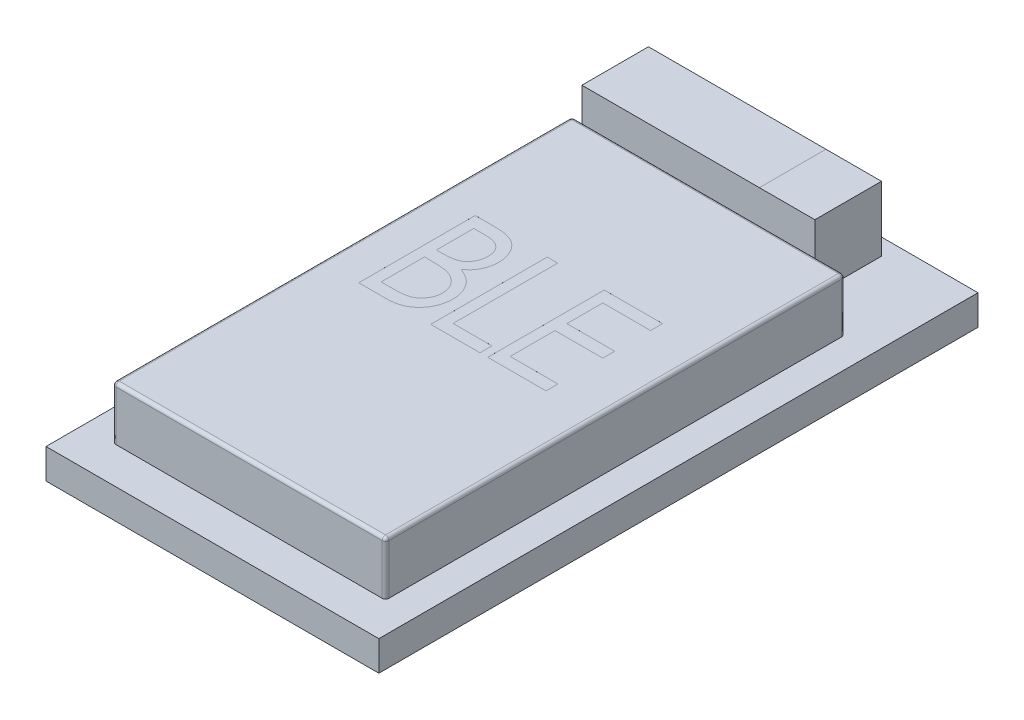
from build123d import *

# Parameters (mm, degrees)
SCHIZZO1_W                   = 10
SCHIZZO1_H                   = 18
ESTRUSIONE_ESTRUSIONE1_DEPTH = 0.9
SCHIZZO2_W                   = 8.2
SCHIZZO2_H                   = 13.8
ESTRUSIONE_ESTRUSIONE2_DEPTH = 1.6
RACCORDO1_R                  = 0.1
SCHIZZO3_W                   = 7
SCHIZZO3_H                   = 2
ESTRUSIONE_ESTRUSIONE3_DEPTH = 1.95
SCHIZZO4_W                   = 1.668109591
SCHIZZO4_H                   = 2
ESTRUSIONE_ESTRUSIONE4_DEPTH = 0.0001
TAGLIO_ESTRUSIONE1_DEPTH     = 0.0001


with BuildPart() as part:
    # Schizzo1 → Estrusione-Estrusione1 (new body)
    with BuildSketch(Plane(origin=(0, 0, 0), x_dir=(1, 0, 0), z_dir=(0, 1, 0))):
        with Locations((-8.221633561, 21.179815737)):
            Rectangle(SCHIZZO1_W, SCHIZZO1_H)
    extrude(amount=ESTRUSIONE_ESTRUSIONE1_DEPTH)

    # Schizzo2 → Estrusione-Estrusione2 (add)
    with BuildSketch(Plane(origin=(0, 0.9, 0), x_dir=(1, 0, 0), z_dir=(0, 1, 0))):
        with Locations((-8.221633561, 20.179815737)):
            Rectangle(SCHIZZO2_W, SCHIZZO2_H)
    extrude(amount=ESTRUSIONE_ESTRUSIONE2_DEPTH)

    # Raccordo1
    raccordo1_edges = [part.edges().sort_by_distance(p)[0] for p in [
        (-8.221633561, 2.5, -27.079815737),
        (-12.321633561, 2.5, -20.179815737),
        (-8.221633561, 2.5, -13.279815737),
        (-4.121633561, 2.5, -20.179815737),
        (-4.121633561, 1.7, -27.079815737),
        (-12.321633561, 1.7, -27.079815737),
        (-4.121633561, 1.7, -13.279815737),
        (-12.321633561, 1.7, -13.279815737),
    ]]
    fillet(raccordo1_edges, radius=RACCORDO1_R)

    # Schizzo3 → Estrusione-Estrusione3 (add)
    with BuildSketch(Plane(origin=(0, 0.9, 0), x_dir=(1, 0, 0), z_dir=(0, 1, 0))):
        with Locations((-9.121633561, 28.679815737)):
            Rectangle(SCHIZZO3_W, SCHIZZO3_H)
    extrude(amount=ESTRUSIONE_ESTRUSIONE3_DEPTH)

    # Schizzo4 → Estrusione-Estrusione4 (add)
    with BuildSketch(Plane(origin=(0, 2.85, 0), x_dir=(1, 0, 0), z_dir=(0, 1, 0))):
        with Locations((-6.455688357, 28.679815737)):
            Rectangle(SCHIZZO4_W, SCHIZZO4_H)
    extrude(amount=ESTRUSIONE_ESTRUSIONE4_DEPTH)

    # Schizzo6 → Taglio-Estrusione1 (cut)
    # profile 1 of 3: a face of its own
    with BuildSketch(Plane(origin=(0, 2.5, 0), x_dir=(1, 0, 0), z_dir=(0, 1, 0))):
        with BuildLine():
            Line((-11.18333626, 23.036967042), (-10.585980491, 23.036967042))
            add(Edge.make_bspline(
                [(-10.585980491, 23.036967042), (-10.556757918, 23.03678522), (-10.499904276, 23.036431477), (-10.417361188, 23.031199961), (-10.340080314, 23.023954486), (-10.268280876, 23.012544339), (-10.201566052, 22.998603544), (-10.139771783, 22.982151437), (-10.083222729, 22.961765257), (-10.015457918, 22.930119617), (-9.938223684, 22.88206457), (-9.854529402, 22.812099102), (-9.78313732, 22.726775156), (-9.722323064, 22.629953429), (-9.673670392, 22.524066042), (-9.638173933, 22.411064716), (-9.616750654, 22.292255218), (-9.614144103, 22.21089979), (-9.612823439, 22.169679382)],
                knots=[0, 0, 0, 0, 0.943162248, 1.8349585, 2.668974122, 3.447905888, 4.180328077, 4.868477066, 5.51045498, 6.117996276, 7.27997042, 8.436248577, 9.624427036, 10.855171045, 12.117669478, 13.375131133, 14.670055953, 16, 16, 16, 16], degree=3))
            add(Edge.make_bspline(
                [(-9.612823439, 22.169679382), (-9.614047935, 22.131046402), (-9.616451672, 22.0552082), (-9.635070272, 21.944044799), (-9.666056736, 21.838429225), (-9.708618617, 21.738551458), (-9.763621138, 21.645972855), (-9.83055156, 21.562203829), (-9.909294115, 21.487196653), (-9.96931091, 21.44603023), (-9.99984267, 21.425088036)],
                knots=[0, 0, 0, 0, 1.056727506, 2.074401545, 3.074053978, 4.06237172, 5.037358539, 6.011107225, 6.988209916, 8, 8, 8, 8], degree=3))
            add(Edge.make_bspline(
                [(-9.99984267, 21.425088036), (-9.961248483, 21.409809488), (-9.887265976, 21.380521521), (-9.785411618, 21.328837906), (-9.697468281, 21.272818517), (-9.623081936, 21.21152064), (-9.560051004, 21.144878781), (-9.503484481, 21.073755117), (-9.45652195, 20.994717989), (-9.415307196, 20.910582618), (-9.383540649, 20.821134133), (-9.359802935, 20.727569426), (-9.346771767, 20.630150004), (-9.344659519, 20.563911975), (-9.34359267, 20.530456626)],
                knots=[0, 0, 0, 0, 1.253473359, 2.402825568, 3.44468963, 4.397487603, 5.306318866, 6.211633052, 7.136718514, 8.0777245, 9.038026576, 9.998665997, 10.989170872, 12, 12, 12, 12], degree=3))
            add(Edge.make_bspline(
                [(-9.34359267, 20.530456626), (-9.344371159, 20.496295585), (-9.345901653, 20.429135598), (-9.358853486, 20.330555016), (-9.379825813, 20.236189612), (-9.409247639, 20.145579665), (-9.448455972, 20.059389392), (-9.494162007, 19.975984669), (-9.550661545, 19.898237389), (-9.612850487, 19.823999537), (-9.683059281, 19.756708814), (-9.759379857, 19.697420914), (-9.842370659, 19.648304714), (-9.930495829, 19.607130032), (-10.024881352, 19.57565851), (-10.125013365, 19.553642628), (-10.230539401, 19.538842788), (-10.30290858, 19.537601366), (-10.339886741, 19.536967042)],
                knots=[0, 0, 0, 0, 1.038509558, 2.041690987, 3.017614995, 3.975041845, 4.932626952, 5.89352943, 6.861815316, 7.850082867, 8.835279032, 9.81329694, 10.782286797, 11.761646577, 12.766261968, 13.800775556, 14.87627195, 16, 16, 16, 16], degree=3))
            Line((-10.339886741, 19.536967042), (-11.18333626, 19.536967042))
            Line((-11.18333626, 19.536967042), (-11.18333626, 23.036967042))
        make_face()
        with BuildLine():
            Line((-10.869233696, 22.677992683), (-10.869233696, 21.556197812))
            Line((-10.869233696, 21.556197812), (-10.6988611, 21.556197812))
            add(Edge.make_bspline(
                [(-10.6988611, 21.556197812), (-10.673854736, 21.556592078), (-10.62569681, 21.557351367), (-10.555722852, 21.559637026), (-10.491018039, 21.565702888), (-10.431227643, 21.572061213), (-10.376946497, 21.582021267), (-10.327910207, 21.594095415), (-10.283261, 21.60684395), (-10.231560992, 21.628523478), (-10.172624672, 21.660482303), (-10.111255478, 21.710840001), (-10.056467703, 21.769444681), (-10.010583537, 21.837549673), (-9.973614198, 21.912625579), (-9.945917416, 21.992329047), (-9.930358337, 22.076765604), (-9.92808624, 22.134094532), (-9.926926004, 22.163369286)],
                knots=[0, 0, 0, 0, 1.068645243, 2.058025688, 2.990115549, 3.844744776, 4.626241161, 5.345550605, 6.002630039, 6.607150377, 7.738038243, 8.853076426, 9.983611551, 11.155164805, 12.347513366, 13.550642837, 14.749246986, 16, 16, 16, 16], degree=3))
            add(Edge.make_bspline(
                [(-9.926926004, 22.163369286), (-9.927251191, 22.182790204), (-9.927888162, 22.220831438), (-9.935162487, 22.276184684), (-9.946391237, 22.328484076), (-9.961517031, 22.377797224), (-9.982046532, 22.423544272), (-10.006888112, 22.465963697), (-10.035563515, 22.505612332), (-10.069583212, 22.541548282), (-10.108293681, 22.573919425), (-10.152089828, 22.602461682), (-10.201810962, 22.624995303), (-10.255933951, 22.645249979), (-10.316108849, 22.659230215), (-10.381104259, 22.670785036), (-10.451486287, 22.676808751), (-10.499966931, 22.677589709), (-10.524982895, 22.677992683)],
                knots=[0, 0, 0, 0, 1.033315509, 2.02403391, 2.965976521, 3.878877932, 4.764409291, 5.628620732, 6.492115432, 7.363461866, 8.255524103, 9.173498167, 10.136325718, 11.155690621, 12.24501133, 13.419065984, 14.668240628, 16, 16, 16, 16], degree=3))
            Line((-10.524982895, 22.677992683), (-10.869233696, 22.677992683))
        make_face(mode=Mode.SUBTRACT)
        with BuildLine():
            Line((-10.869233696, 21.197223453), (-10.869233696, 19.895941401))
            Line((-10.869233696, 19.895941401), (-10.491329048, 19.895941401))
            add(Edge.make_bspline(
                [(-10.491329048, 19.895941401), (-10.46445137, 19.89632483), (-10.41255208, 19.897065208), (-10.337464441, 19.899496266), (-10.267715065, 19.904954214), (-10.203732243, 19.913671629), (-10.145028998, 19.922876312), (-10.092222576, 19.93582235), (-10.044701766, 19.950017485), (-9.989226719, 19.972710346), (-9.926617784, 20.007346133), (-9.860139656, 20.060360966), (-9.800356185, 20.122308244), (-9.750676544, 20.194814149), (-9.709301938, 20.273009579), (-9.679846384, 20.356156935), (-9.660487079, 20.442157757), (-9.658629584, 20.500905548), (-9.657695234, 20.530456626)],
                knots=[0, 0, 0, 0, 1.081619098, 2.088545823, 3.022572722, 3.895065755, 4.686620152, 5.411945446, 6.081214222, 6.68019563, 7.821024448, 8.946046415, 10.090087698, 11.271885441, 12.47066001, 13.639667357, 14.812714956, 16, 16, 16, 16], degree=3))
            add(Edge.make_bspline(
                [(-9.657695234, 20.530456626), (-9.65917021, 20.567082629), (-9.662065056, 20.638966271), (-9.68913194, 20.742656198), (-9.732358198, 20.839191274), (-9.793324744, 20.926710364), (-9.86822419, 21.004860445), (-9.957439354, 21.070109101), (-10.059526588, 21.12209033), (-10.13402488, 21.144393136), (-10.172318632, 21.155857267)],
                knots=[0, 0, 0, 0, 1.002523699, 1.967592627, 2.916812078, 3.889001818, 4.876880315, 5.871365521, 6.905835296, 8, 8, 8, 8], degree=3))
            add(Edge.make_bspline(
                [(-10.172318632, 21.155857267), (-10.186069714, 21.15930447), (-10.215702955, 21.166733109), (-10.264467246, 21.174795955), (-10.32014203, 21.181702263), (-10.382849108, 21.186962139), (-10.452223751, 21.192339627), (-10.528950356, 21.194468202), (-10.612607666, 21.196940284), (-10.670813657, 21.197126825), (-10.700964465, 21.197223453)],
                knots=[0, 0, 0, 0, 0.639967164, 1.379113422, 2.229991931, 3.173071501, 4.220511108, 5.371654984, 6.638512572, 8, 8, 8, 8], degree=3))
            Line((-10.700964465, 21.197223453), (-10.869233696, 21.197223453))
        make_face(mode=Mode.SUBTRACT)
    # profile 2 of 3: a face of its own
    with BuildSketch(Plane(origin=(0, 2.5, 0), x_dir=(1, 0, 0), z_dir=(0, 1, 0))):
        Polygon((-9.020515747, 23.036967042), (-8.706413183, 23.036967042), (-8.706413183, 19.895941401), (-7.539746516, 19.895941401), (-7.539746516, 19.536967042), (-9.020515747, 19.536967042), align=None)
    # profile 3 of 3: a face of its own
    with BuildSketch(Plane(origin=(0, 2.5, 0), x_dir=(1, 0, 0), z_dir=(0, 1, 0))):
        Polygon((-7.306413183, 23.036967042), (-5.556413183, 23.036967042), (-5.556413183, 22.677992683), (-6.992310619, 22.677992683), (-6.992310619, 21.601069607), (-5.556413183, 21.601069607), (-5.556413183, 21.242095248), (-6.992310619, 21.242095248), (-6.992310619, 19.895941401), (-5.556413183, 19.895941401), (-5.556413183, 19.536967042), (-7.306413183, 19.536967042), align=None)
    extrude(amount=-TAGLIO_ESTRUSIONE1_DEPTH, mode=Mode.SUBTRACT)


solid = part.part
